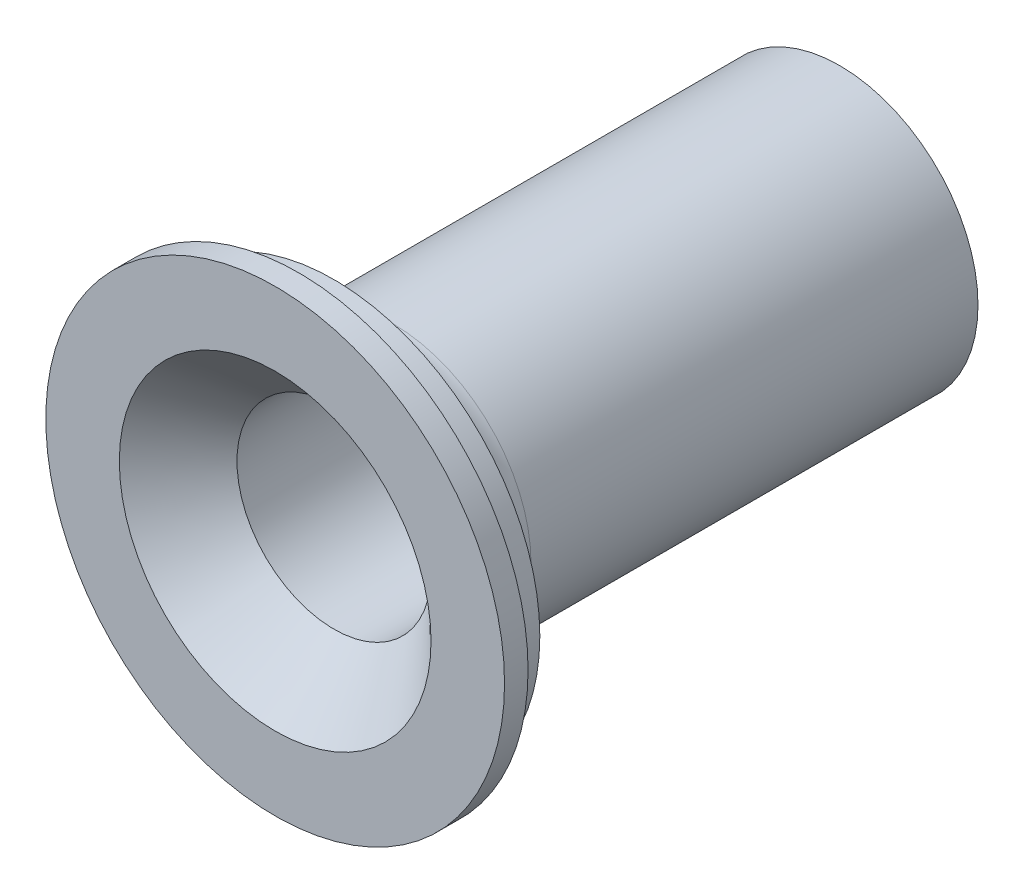
from build123d import *


with BuildPart() as part:
    # Szkic1 → Obrót1 (revolve)
    with BuildSketch(Plane(origin=(0, 0, 0), x_dir=(1, 0, 0), z_dir=(0, 1, 0))):
        with BuildLine():
            Line((2, 46), (8.25, 46))
            Line((8.25, 46), (8.25, 48))
            Line((8.25, 48), (11.75, 48))
            Line((11.75, 48), (11.75, 10))
            ThreePointArc((11.75, 10), (13.214466094, 6.464466094), (16.75, 5))
            Line((16.75, 5), (17.5, 5))
            Line((17.5, 5), (17.5, 2))
            Line((17.5, 2), (19.5, 2))
            Line((19.5, 2), (19.5, 0))
            Line((19.5, 0), (13.25, 0))
            Line((13.25, 0), (8.25, 5))
            Line((8.25, 5), (8.25, 38))
            ThreePointArc((8.25, 38), (7.371320344, 40.121320344), (5.25, 41))
            Line((5.25, 41), (2, 41))
            Line((2, 41), (2, 46))
        make_face()
    revolve(axis=Axis((0, 0, 0), (0, 0, -1)))


solid = part.part
